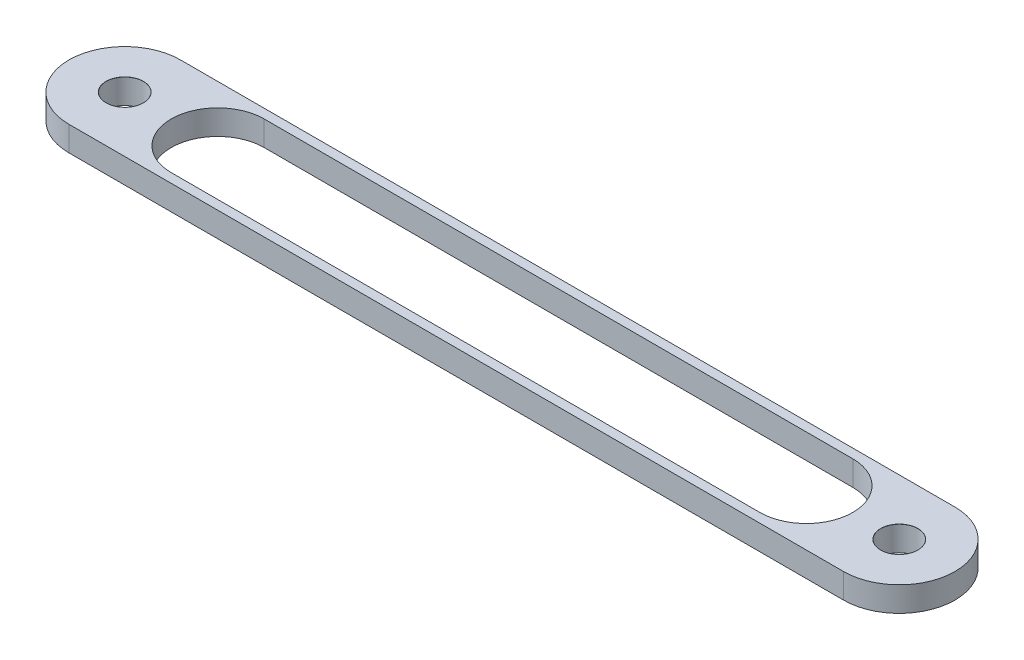
from build123d import *

# Parameters (mm, degrees)
BOSS_EXTRU_1_DEPTH          = 4
D_GAGEMENT_M101_D           = 12
D_GAGEMENT_M101_CSINK_D     = 12.05
D_GAGEMENT_M101_CSINK_ANGLE = 90


with BuildPart() as part:
    # Esquisse1 → Boss.-Extru.1 (new, symmetric)
    with BuildSketch(Plane(origin=(0, 0, 0), x_dir=(1, 0, 0), z_dir=(0, 1, 0))):
        with BuildLine():
            Line((0, 18), (250, 18))
            ThreePointArc((250, 18), (268, 0), (250, -18))
            Line((250, -18), (0, -18))
            ThreePointArc((0, -18), (-18, 0), (0, 18))
        make_face()
        with BuildLine():
            Line((30, 15), (220, 15))
            ThreePointArc((220, 15), (235, 0), (220, -15))
            Line((220, -15), (30, -15))
            ThreePointArc((30, -15), (15, 0), (30, 15))
        make_face(mode=Mode.SUBTRACT)
    extrude(amount=BOSS_EXTRU_1_DEPTH, both=True)

    # Dégagement M101 (through all)
    with Locations(Plane(origin=(0, 4, 0), x_dir=(1, 0, 0), z_dir=(0, 1, 0))):
        with Locations((250, 0), (0, 0)):
            CounterSinkHole(D_GAGEMENT_M101_D / 2, D_GAGEMENT_M101_CSINK_D / 2, counter_sink_angle=D_GAGEMENT_M101_CSINK_ANGLE)


solid = part.part
